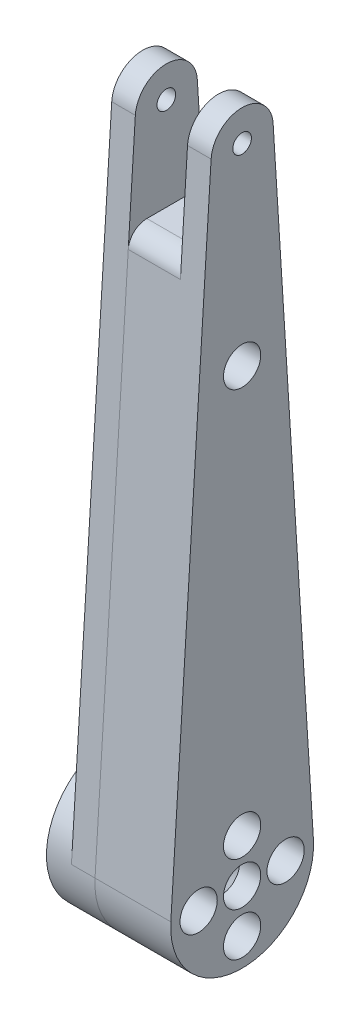
from build123d import *

# Parameters (mm, degrees)
SKETCH1_R                                           = 1.5
SKETCH1_R_2                                         = 1.7
BOSS_EXTRUDE1_DEPTH                                 = 16
BOSS_EXTRUDE2_START                                 = -4
SKETCH1_4_R                                         = 11.5
SKETCH1_4_R_2                                       = 10.25
BOSS_EXTRUDE2_DEPTH                                 = 4
BOSS_EXTRUDE3_START                                 = -2
SKETCH1_5_R                                         = 10.25
SKETCH1_5_R_2                                       = 1.7
BOSS_EXTRUDE3_DEPTH                                 = 2
CBORE_FOR_M3_HEX_SOCKET_HEAD_CAP_SCREW1_D           = 3.4
CBORE_FOR_M3_HEX_SOCKET_HEAD_CAP_SCREW1_CBORE_D     = 6
CBORE_FOR_M3_HEX_SOCKET_HEAD_CAP_SCREW1_CBORE_DEPTH = 9.2
CHAMFER1_SIZE                                       = 1.3
CIRPATTERN2_COUNT                                   = 4
CHAMFER1_OF_CIRPATTERN2_SIZE                        = 1.3
SKETCH4_R                                           = 3
CUT_EXTRUDE2_DEPTH                                  = 4.7
CHAMFER2_SIZE                                       = 1.3
CUT_EXTRUDE5_DEPTH                                  = 111.274657107
CUT_EXTRUDE5_DEPTH_BACK                             = 111.274657107
SKETCH6_W                                           = 8.4
SKETCH6_H                                           = 20
FILLET1_R                                           = 3
SKETCH9_R                                           = 1.7
CUT_EXTRUDE6_DEPTH                                  = 110.765659475
CHAMFER3_SIZE                                       = 1.3


with BuildPart() as part:
    # Sketch1 → Boss-Extrude1 (new body)
    with BuildSketch(Plane(origin=(0, 0, 0), x_dir=(0, 0, -1), z_dir=(1, 0, 0))):
        with BuildLine():
            Line((-4.990130052, 103.814009662), (-11.477299119, 0.722222222))
            ThreePointArc((-11.477299119, 0.722222222), (0, -11.5), (11.477299119, 0.722222222))
            Line((11.477299119, 0.722222222), (4.990130052, 103.814009662))
            ThreePointArc((4.990130052, 103.814009662), (0, 108.5), (-4.990130052, 103.814009662))
        make_face()
        with Locations((0, 103.5)):
            Circle(SKETCH1_R, mode=Mode.SUBTRACT)
        Circle(SKETCH1_R_2, mode=Mode.SUBTRACT)
    extrude(amount=BOSS_EXTRUDE1_DEPTH)

    # Sketch1<4> → Boss-Extrude2 (add)
    with BuildSketch(Plane(origin=(0, 0, 0), x_dir=(0, 0, -1), z_dir=(1, 0, 0)).offset(BOSS_EXTRUDE2_START)):
        with Locations(Location((0, 0, 0), (0, 0, 176.399344799))):
            Circle(SKETCH1_4_R)
        Circle(SKETCH1_4_R_2, mode=Mode.SUBTRACT)
    extrude(amount=BOSS_EXTRUDE2_DEPTH)

    # Sketch1<5> → Boss-Extrude3 (add)
    with BuildSketch(Plane(origin=(0, 0, 0), x_dir=(0, 0, -1), z_dir=(1, 0, 0)).offset(BOSS_EXTRUDE3_START)):
        Circle(SKETCH1_5_R)
        Circle(SKETCH1_5_R_2, mode=Mode.SUBTRACT)
    extrude(amount=BOSS_EXTRUDE3_DEPTH)

    # CBORE for M3 Hex Socket Head Cap Screw1 (through all)
    with Locations(Plane(origin=(16, 0, 0), x_dir=(0, 0, -1), z_dir=(1, 0, 0))):
        with Locations((0, 7)):
            cbore_for_m3_hex_socket_head_cap_screw1 = CounterBoreHole(CBORE_FOR_M3_HEX_SOCKET_HEAD_CAP_SCREW1_D / 2, CBORE_FOR_M3_HEX_SOCKET_HEAD_CAP_SCREW1_CBORE_D / 2, CBORE_FOR_M3_HEX_SOCKET_HEAD_CAP_SCREW1_CBORE_DEPTH)

    # Chamfer1
    chamfer1_edges = [part.edges().sort_by_distance(p)[0] for p in [
        (6.8, 7, 3),
    ]]
    chamfer(chamfer1_edges, length=CHAMFER1_SIZE - 0.0001)  # a hair under: the kernel refuses the full size

    # CirPattern2: CBORE for M3 Hex Socket Head Cap Screw1 ×4 about axis
    cirpattern2_axis = Axis((0, 0, 0), (1, 0, 0))
    for i in range(1, CIRPATTERN2_COUNT):
        add(cbore_for_m3_hex_socket_head_cap_screw1.rotate(cirpattern2_axis, i * 360 / CIRPATTERN2_COUNT), mode=Mode.SUBTRACT)

    # Chamfer1 of CirPattern2
    chamfer1_of_cirpattern2_edges = [part.edges().sort_by_distance(p)[0] for p in [
        (6.8, -3, 7),
        (6.8, -7, -3),
        (6.8, 3, -7),
    ]]
    chamfer(chamfer1_of_cirpattern2_edges, length=CHAMFER1_OF_CIRPATTERN2_SIZE - 0.0001)  # a hair under: the kernel refuses the full size

    # Sketch4 → Cut-Extrude2 (cut)
    with BuildSketch(Plane(origin=(16, 0, 0), x_dir=(0, 0, -1), z_dir=(1, 0, 0))):
        Circle(SKETCH4_R)
    extrude(amount=-CUT_EXTRUDE2_DEPTH, mode=Mode.SUBTRACT)

    # Chamfer2
    chamfer2_edges = [part.edges().sort_by_distance(p)[0] for p in [
        (11.3, 0, 3),
    ]]
    chamfer(chamfer2_edges, length=CHAMFER2_SIZE - 0.0001)  # a hair under: the kernel refuses the full size

    # Sketch6 → Cut-Extrude5 (cut, two sides: drawn at the far end of the back side and taken through both)
    with BuildSketch(Plane.XY.offset(-CUT_EXTRUDE5_DEPTH_BACK)):
        with Locations((8, 98.5)):
            Rectangle(SKETCH6_W, SKETCH6_H)
    extrude(amount=CUT_EXTRUDE5_DEPTH + CUT_EXTRUDE5_DEPTH_BACK, mode=Mode.SUBTRACT)

    # Fillet1
    fillet1_edges = [part.edges().sort_by_distance(p)[0] for p in [
        (8, 88.5, -5.953781689),
        (8, 88.5, 5.953781689),
    ]]
    fillet(fillet1_edges, radius=FILLET1_R)


with BuildPart() as body_2:
    # Split1: the piece on the far side of the plane
    add(part.part)
    split(bisect_by=Plane.YZ.offset(3.8), keep=Keep.BOTTOM)


with BuildPart() as part_1:
    add(part.part)

    # Split1
    split(bisect_by=Plane.YZ.offset(3.8), keep=Keep.TOP)


with BuildPart() as cbore_for_m3_hex_socket_head_cap_screw2_tool:
    # Sketch8 → CBORE for M3 Hex Socket Head Cap Screw2 (revolve)
    with BuildSketch(Plane(origin=(16, 72.5, 0), x_dir=(0, 0, -1), z_dir=(0, 1, 0))):
        Polygon((0, 0), (0, 20), (1.5, 20), (1.5, 8), (3, 8), (3, 0), align=None)
    revolve(axis=Axis((22.35, 72.5, 0), (-1, 0, 0)))


with BuildPart() as part_2:
    add(part_1.part)

    # CBORE for M3 Hex Socket Head Cap Screw2: cut by cbore_for_m3_hex_socket_head_cap_screw2_tool
    add(cbore_for_m3_hex_socket_head_cap_screw2_tool.part, mode=Mode.SUBTRACT)

    # Sketch9 → Cut-Extrude6 (cut, through all)
    with BuildSketch(Plane(origin=(8, 0, 0), x_dir=(0, 0, -1), z_dir=(1, 0, 0))):
        with Locations((0, 72.5)):
            Circle(SKETCH9_R)
    extrude(amount=-CUT_EXTRUDE6_DEPTH, mode=Mode.SUBTRACT)

    # Chamfer3
    chamfer3_edges = [part_2.edges().sort_by_distance(p)[0] for p in [
        (8, 72.5, 3),
    ]]
    chamfer(chamfer3_edges, length=CHAMFER3_SIZE - 0.0001)  # a hair under: the kernel refuses the full size


with BuildPart() as body_2_1:
    add(body_2.part)

    # CBORE for M3 Hex Socket Head Cap Screw2: cut by cbore_for_m3_hex_socket_head_cap_screw2_tool
    add(cbore_for_m3_hex_socket_head_cap_screw2_tool.part, mode=Mode.SUBTRACT)


solid = Compound([part_2.part, body_2_1.part])
